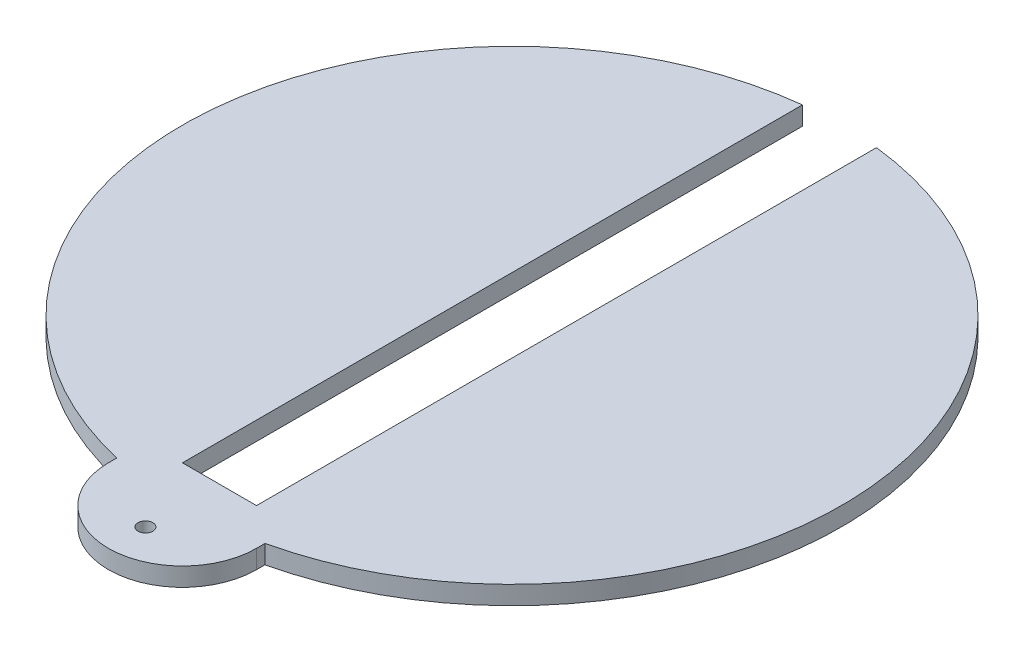
from build123d import *

# Parameters (mm, degrees)
BOSS_EXTRUDE1_DEPTH     = 3.175
SKETCH3_R               = 1.27
CUT_EXTRUDE1_DEPTH      = 90.413321575
CUT_EXTRUDE2_DEPTH      = 90.413321575
CUT_EXTRUDE2_DEPTH_BACK = 90.413321575


with BuildPart() as part:
    # Sketch2 → Boss-Extrude1 (new body)
    with BuildSketch(Plane(origin=(0, 0, 0), x_dir=(1, 0, 0), z_dir=(0, 1, 0))):
        with BuildLine():
            Line((6.35, 56.515), (56.515, 56.515))
            Line((56.515, 56.515), (56.515, -56.515))
            Line((56.515, -56.515), (12.7, -56.515))
            ThreePointArc((12.7, -56.515), (0, -69.215), (-12.7, -56.515))
            Line((-12.7, -56.515), (-56.515, -56.515))
            Line((-56.515, -56.515), (-56.515, 56.515))
            Line((-56.515, 56.515), (-6.35, 56.515))
            Line((-6.35, 56.515), (-6.35, -50.165))
            Line((-6.35, -50.165), (6.35, -50.165))
            Line((6.35, -50.165), (6.35, 56.515))
        make_face()
    extrude(amount=BOSS_EXTRUDE1_DEPTH)

    # Sketch3 → Cut-Extrude1 (cut, through all)
    with BuildSketch(Plane(origin=(0, 3.175, 0), x_dir=(1, 0, 0), z_dir=(0, 1, 0))):
        with Locations((0, -62.865)):
            Circle(SKETCH3_R)
    extrude(amount=-CUT_EXTRUDE1_DEPTH, mode=Mode.SUBTRACT)

    # Sketch4 → Cut-Extrude2 (cut, two sides: drawn at the far end of the back side and taken through both)
    with BuildSketch(Plane(origin=(0, 3.175, 0), x_dir=(1, 0, 0), z_dir=(0, 1, 0)).offset(-CUT_EXTRUDE2_DEPTH_BACK)):
        with BuildLine():
            Line((56.515, -56.515), (56.515, 0))
            ThreePointArc((56.515, 0), (44.224912238, -35.186678765), (12.7, -55.069548981))
            Line((12.7, -55.069548981), (12.7, -56.515))
            Line((12.7, -56.515), (56.515, -56.515))
        make_face()
        with BuildLine():
            ThreePointArc((-12.7, -55.069548981), (-44.224912226, -35.18667878), (-56.515, -3.9e-08))
            Line((-56.515, -3.9e-08), (-56.515, -56.515))
            Line((-56.515, -56.515), (-12.7, -56.515))
            Line((-12.7, -56.515), (-12.7, -55.069548981))
        make_face()
        with BuildLine():
            Line((-6.35, 56.515), (-56.515, 56.515))
            Line((-56.515, 56.515), (-56.515, -3.9e-08))
            ThreePointArc((-56.515, -3.9e-08), (-42.147452338, 37.650199022), (-6.35, 56.157125327))
            Line((-6.35, 56.157125327), (-6.35, 56.515))
        make_face()
        with BuildLine():
            Line((56.515, 56.515), (6.35, 56.515))
            Line((6.35, 56.515), (6.35, 56.157125327))
            ThreePointArc((6.35, 56.157125327), (42.147452325, 37.650199037), (56.515, 0))
            Line((56.515, 0), (56.515, 56.515))
        make_face()
    extrude(amount=CUT_EXTRUDE2_DEPTH + CUT_EXTRUDE2_DEPTH_BACK, mode=Mode.SUBTRACT)


solid = part.part
